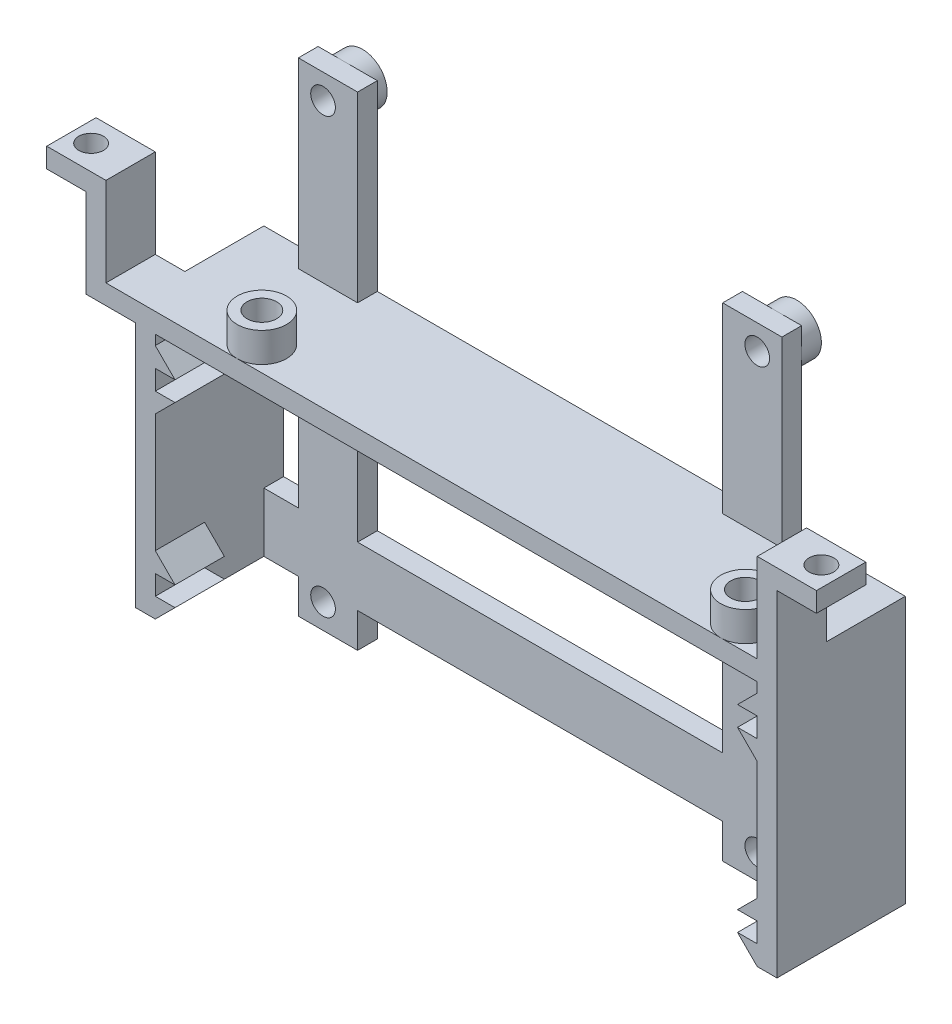
from build123d import *

# Parameters (mm, degrees)
SKETCH1_W           = 66
SKETCH1_H           = 5
BASE_FLANGE1_DEPTH  = 2
SKETCH2_R           = 2.5
BOSS_EXTRUDE1_DEPTH = 3
SKETCH3_W           = 2
SKETCH3_H           = 5
BOSS_EXTRUDE2_DEPTH = 11
SKETCH4_W           = 6
SKETCH4_H           = 5
BOSS_EXTRUDE3_DEPTH = 2
SKETCH5_R           = 1.5
CUT_EXTRUDE1_DEPTH  = 40.537956447
SKETCH6_R           = 1.25
CUT_EXTRUDE2_DEPTH  = 41.598645298
SKETCH7_W           = 2
SKETCH7_H           = 5
BOSS_EXTRUDE4_DEPTH = 25
BOSS_EXTRUDE5_DEPTH = 5
BOSS_EXTRUDE6_DEPTH = 8
SKETCH13_W          = 65
SKETCH13_H          = 6
BOSS_EXTRUDE8_DEPTH = 2
SKETCH12_W          = 6
SKETCH12_H          = 49
BOSS_EXTRUDE7_DEPTH = 2
SKETCH14_R          = 2.5
BOSS_EXTRUDE9_DEPTH = 2
CUT_EXTRUDE3_REACH  = 53.732
SKETCH15_R          = 1.25


# Sheet-metal steps are written as plain solids
with BuildPart() as part:
    # Sketch1 → Base-Flange1 (new body)
    with BuildSketch(Plane(origin=(0, 0, 0), x_dir=(1, 0, 0), z_dir=(0, 1, 0))):
        Rectangle(SKETCH1_W, SKETCH1_H)
    extrude(amount=-BASE_FLANGE1_DEPTH)

    # Sketch2 → Boss-Extrude1 (add)
    with BuildSketch(Plane(origin=(0, 0, 0), x_dir=(-1, 0, 0), z_dir=(0, -1, 0))):
        with Locations(Location((19.7, 0, 0), (0, 0, 90))):
            Circle(SKETCH2_R)
        with Locations(Location((-29.3, 0, 0), (0, 0, 90))):
            Circle(SKETCH2_R)
    extrude(amount=-BOSS_EXTRUDE1_DEPTH)

    # Sketch3 → Boss-Extrude2 (add)
    with BuildSketch(Plane(origin=(0, -2, 0), x_dir=(-1, 0, 0), z_dir=(0, -1, 0))):
        with Locations((-34, 0)):
            Rectangle(SKETCH3_W, SKETCH3_H)
    boss_extrude2 = extrude(amount=-BOSS_EXTRUDE2_DEPTH)

    # Sketch4 → Boss-Extrude3 (add)
    with BuildSketch(Plane(origin=(0, 9, 0), x_dir=(1, 0, 0), z_dir=(0, 1, 0))):
        with Locations((36, 0)):
            Rectangle(SKETCH4_W, SKETCH4_H)
    boss_extrude3 = extrude(amount=-BOSS_EXTRUDE3_DEPTH)

    # Mirror1: Boss-Extrude2, Boss-Extrude3 across plane
    add(boss_extrude2.mirror(Plane(origin=(0, 0, 0), x_dir=(0, 0, 1), z_dir=(1, 0, 0))))
    add(boss_extrude3.mirror(Plane(origin=(0, 0, 0), x_dir=(0, 0, 1), z_dir=(1, 0, 0))))

    # Sketch5 → Cut-Extrude1 (cut, through all)
    with BuildSketch(Plane(origin=(0, 3, 0), x_dir=(1, 0, 0), z_dir=(0, 1, 0))):
        with Locations(Location((-19.7, 0, 0), (0, 0, 270))):
            Circle(SKETCH5_R)
        with Locations(Location((29.3, 0, 0), (0, 0, 270))):
            Circle(SKETCH5_R)
    extrude(amount=-CUT_EXTRUDE1_DEPTH, mode=Mode.SUBTRACT)

    # Sketch6 → Cut-Extrude2 (cut, through all)
    with BuildSketch(Plane(origin=(0, 9, 0), x_dir=(1, 0, 0), z_dir=(0, 1, 0))):
        with Locations(Location((-37, 0, 0), (0, 0, 270))):
            Circle(SKETCH6_R)
        with Locations(Location((37, 0, 0), (0, 0, 270))):
            Circle(SKETCH6_R)
    extrude(amount=-CUT_EXTRUDE2_DEPTH, mode=Mode.SUBTRACT)

    # Sketch7 → Boss-Extrude4 (add)
    with BuildSketch(Plane(origin=(0, -2, 0), x_dir=(-1, 0, 0), z_dir=(0, -1, 0))):
        with Locations((29, 0)):
            Rectangle(SKETCH7_W, SKETCH7_H)
    boss_extrude4 = extrude(amount=BOSS_EXTRUDE4_DEPTH)

    # Sketch8 → Boss-Extrude5 (add)
    with BuildSketch(Plane.XY.offset(2.5)):
        Polygon((-28, -3), (-26, -5), (-28, -5), align=None)
        Polygon((-28, -7), (-26, -7), (-28, -9), align=None)
        Polygon((-28, -21), (-28, -23), (-26, -23), align=None)
        Polygon((-28, -25), (-28, -27), (-26, -25), align=None)
    boss_extrude5 = extrude(amount=-BOSS_EXTRUDE5_DEPTH)

    # Mirror2: Boss-Extrude4, Boss-Extrude5 across plane
    add(boss_extrude4.mirror(Plane(origin=(2.5, 0, 0), x_dir=(0, 0, 1), z_dir=(1, 0, 0))))
    add(boss_extrude5.mirror(Plane(origin=(2.5, 0, 0), x_dir=(0, 0, 1), z_dir=(1, 0, 0))))

    # Sketch11 → Boss-Extrude6 (add)
    with BuildSketch(Plane.XY.offset(-2.5)):
        Polygon((-30, -27), (-30, 0), (35, 0), (35, -27), (33, -27), (33, -2), (-28, -2), (-28, -27), align=None)
    extrude(amount=-BOSS_EXTRUDE6_DEPTH)

    # Sketch13 → Boss-Extrude8 (add)
    with BuildSketch(Plane(origin=(0, 0, -10.5), x_dir=(-1, 0, 0), z_dir=(0, 0, -1))):
        with Locations((-2.5, -24)):
            Rectangle(SKETCH13_W, SKETCH13_H)
    extrude(amount=-BOSS_EXTRUDE8_DEPTH)

    # Sketch12 → Boss-Extrude7 (add)
    with BuildSketch(Plane(origin=(0, 0, -10.5), x_dir=(-1, 0, 0), z_dir=(0, 0, -1))):
        with Locations((-21.5, -6)):
            Rectangle(SKETCH12_W, SKETCH12_H)
        with Locations((21.5, -6)):
            Rectangle(SKETCH12_W, SKETCH12_H)
    extrude(amount=-BOSS_EXTRUDE7_DEPTH)

    # Sketch14 → Boss-Extrude9 (add)
    with BuildSketch(Plane(origin=(0, 0, -10.5), x_dir=(-1, 0, 0), z_dir=(0, 0, -1))):
        with Locations(Location((-22, 16, 0), (0, 0, 180))):
            Circle(SKETCH14_R)
        with Locations(Location((22, 16, 0), (0, 0, 180))):
            Circle(SKETCH14_R)
        with Locations(Location((-22, -28, 0), (0, 0, 180))):
            Circle(SKETCH14_R)
        with Locations(Location((22, -28, 0), (0, 0, 180))):
            Circle(SKETCH14_R)
    extrude(amount=BOSS_EXTRUDE9_DEPTH)

    # Sketch15 → Cut-Extrude3 (cut, up to next)
    with BuildSketch(Plane(origin=(0, 0, -12.5), x_dir=(-1, 0, 0), z_dir=(0, 0, -1)), mode=Mode.PRIVATE) as cut_extrude3_sk1:
        with Locations((-22, 16)):
            Circle(SKETCH15_R)
    cut_extrude3_tool1 = extrude(cut_extrude3_sk1.sketch, amount=-CUT_EXTRUDE3_REACH, mode=Mode.PRIVATE) & part.part
    # Sketch15 → Cut-Extrude3 (cut, up to next)
    with BuildSketch(Plane(origin=(0, 0, -12.5), x_dir=(-1, 0, 0), z_dir=(0, 0, -1)), mode=Mode.PRIVATE) as cut_extrude3_sk2:
        with Locations(Location((22, 16, 0), (0, 0, 180))):
            Circle(SKETCH15_R)
    cut_extrude3_tool2 = extrude(cut_extrude3_sk2.sketch, amount=-CUT_EXTRUDE3_REACH, mode=Mode.PRIVATE) & part.part
    # Sketch15 → Cut-Extrude3 (cut, up to next)
    with BuildSketch(Plane(origin=(0, 0, -12.5), x_dir=(-1, 0, 0), z_dir=(0, 0, -1)), mode=Mode.PRIVATE) as cut_extrude3_sk3:
        with Locations((22, -28)):
            Circle(SKETCH15_R)
    cut_extrude3_tool3 = extrude(cut_extrude3_sk3.sketch, amount=-CUT_EXTRUDE3_REACH, mode=Mode.PRIVATE) & part.part
    # Sketch15 → Cut-Extrude3 (cut, up to next)
    with BuildSketch(Plane(origin=(0, 0, -12.5), x_dir=(-1, 0, 0), z_dir=(0, 0, -1)), mode=Mode.PRIVATE) as cut_extrude3_sk4:
        with Locations((-22, -28)):
            Circle(SKETCH15_R)
    cut_extrude3_tool4 = extrude(cut_extrude3_sk4.sketch, amount=-CUT_EXTRUDE3_REACH, mode=Mode.PRIVATE) & part.part
    add(cut_extrude3_tool1.solids().sort_by_distance((22, 16, -12.5))[0], mode=Mode.SUBTRACT)
    add(cut_extrude3_tool2.solids().sort_by_distance((-22, 16, -12.5))[0], mode=Mode.SUBTRACT)
    add(cut_extrude3_tool3.solids().sort_by_distance((-22, -28, -12.5))[0], mode=Mode.SUBTRACT)
    add(cut_extrude3_tool4.solids().sort_by_distance((22, -28, -12.5))[0], mode=Mode.SUBTRACT)


solid = part.part
